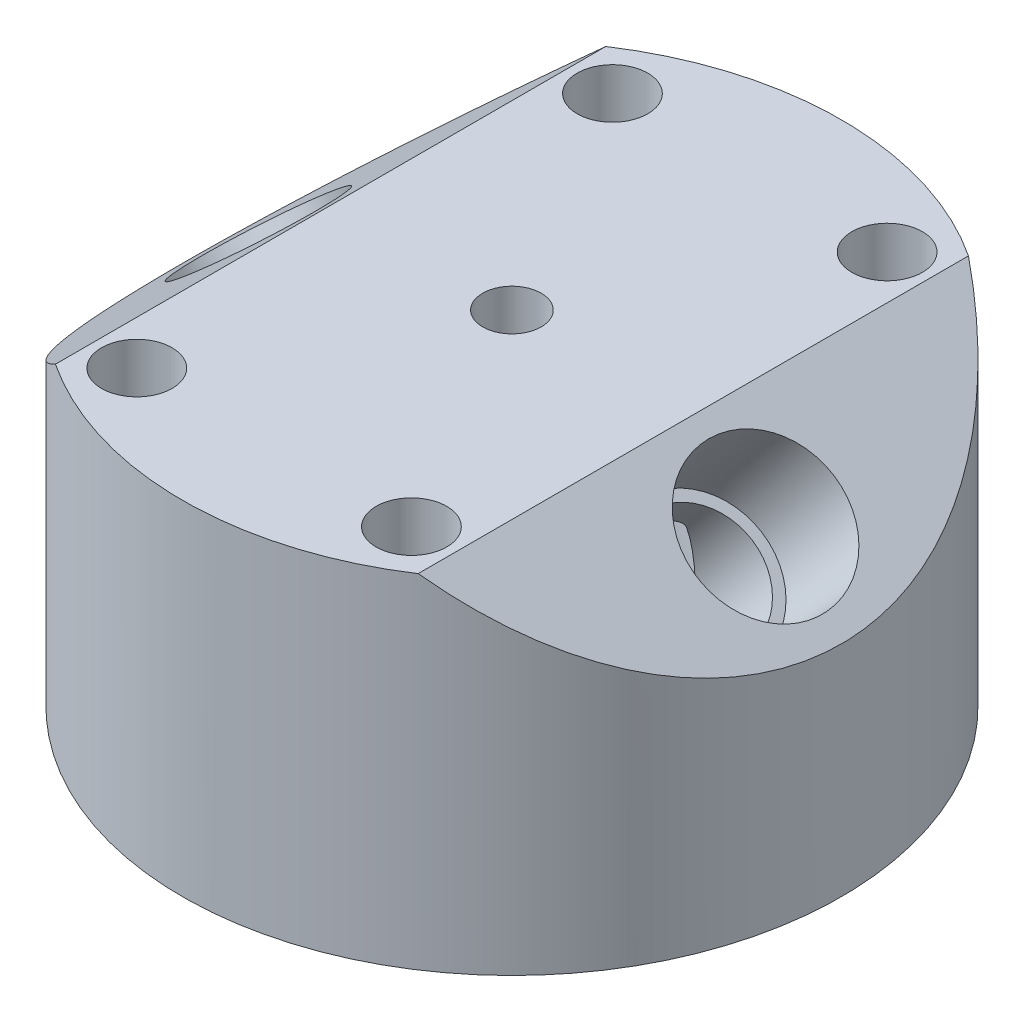
from build123d import *

# Parameters (mm, degrees)
CUT_EXTRUDE1_DEPTH         = 58.529738397
CUT_EXTRUDE1_DEPTH_BACK    = 58.529738397
F_1_4_28_TAPPED_HOLE1_D    = 5.4102
CUT_EXTRUDE2_START         = -6.35
SKETCH5_R                  = 30.48
CUT_EXTRUDE2_DEPTH         = 6.35
USE_ROUND_CORNER_ENDMILL_R = 0.762
F_1_4_CLEARANCE_HOLE1_D    = 6.5278


with BuildPart() as part:
    # MASTER → MASTER_SKETCH (revolve)
    with BuildSketch(Plane.XY):
        Polygon((0, 38.1), (-30.48, 38.1), (-30.48, 0), (-12.7, 0), (-12.7, 19.05), (-6.3246, 19.05), (-4.7625, 17.4879), (0, 17.4879), align=None)
    revolve(axis=Axis((0, 38.1, 0), (0, -1, 0)))

    # Sketch2 → Cut-Extrude1 (cut, two sides: drawn at the far end of the back side and taken through both)
    with BuildSketch(Plane.XY.offset(-CUT_EXTRUDE1_DEPTH_BACK)):
        Polygon((-30.48, 20.248277745), (-9.205145869, 38.1), (-30.48, 38.1), align=None)
        Polygon((30.48, 38.1), (9.205145869, 38.1), (30.48, 20.248277745), align=None)
    extrude(amount=CUT_EXTRUDE1_DEPTH + CUT_EXTRUDE1_DEPTH_BACK, mode=Mode.SUBTRACT)

    # 1/4-28 Tapped Hole1 (through all)
    with Locations(Plane(origin=(0, 38.1, 0), x_dir=(1, 0, 0), z_dir=(0, 1, 0))):
        with Locations((0, 0)):
            Hole(F_1_4_28_TAPPED_HOLE1_D / 2)

    # Sketch5 → Cut-Extrude2 (cut)
    with BuildSketch(Plane(origin=(0, 38.1, 0), x_dir=(1, 0, 0), z_dir=(0, 1, 0)).offset(CUT_EXTRUDE2_START)):
        Circle(SKETCH5_R)
    extrude(amount=CUT_EXTRUDE2_DEPTH, mode=Mode.SUBTRACT)

    # use-round-corner-endmill
    use_round_corner_endmill_edges = [part.edges().sort_by_distance(p)[0] for p in [
        (6.3246, 19.05, 0),
        (12.7, 19.05, 0),
    ]]
    fillet(use_round_corner_endmill_edges, radius=USE_ROUND_CORNER_ENDMILL_R)

    # Sketch7 → 1/4 NPT Tapped Hole1 (revolve, cut)
    with BuildSketch(Plane(origin=(-23.455832083, 26.142254454, 0), x_dir=(-0.7660444431189741, -0.642787609686544, 0), z_dir=(0, 0, 1))):
        Polygon((0, 0), (0, 54.695413336), (5.5626, 54.695413336), (5.5626, 9.906), (6.557984794, 9.906), (6.8545837, 0), align=None)
    f_1_4_npt_tapped_hole1 = revolve(axis=Axis((-27.537533405, 31.006636667, 0), (0.6427876096865441, -0.7660444431189741, 0)), mode=Mode.SUBTRACT)

    # Mirror1: 1/4 NPT Tapped Hole1 across plane
    add(f_1_4_npt_tapped_hole1.mirror(Plane(origin=(0, 0, 0), x_dir=(0, 0, 1), z_dir=(1, 0, 0))), mode=Mode.SUBTRACT)

    # 1/4 Clearance Hole1 (through all)
    with Locations(Plane(origin=(0, 31.75, 0), x_dir=(1, 0, 0), z_dir=(0, 1, 0))):
        with Locations((-12.7, -21.997045256), (12.7, -21.997045256), (12.7, 21.997045256), (-12.7, 21.997045256)):
            Hole(F_1_4_CLEARANCE_HOLE1_D / 2)


solid = part.part
